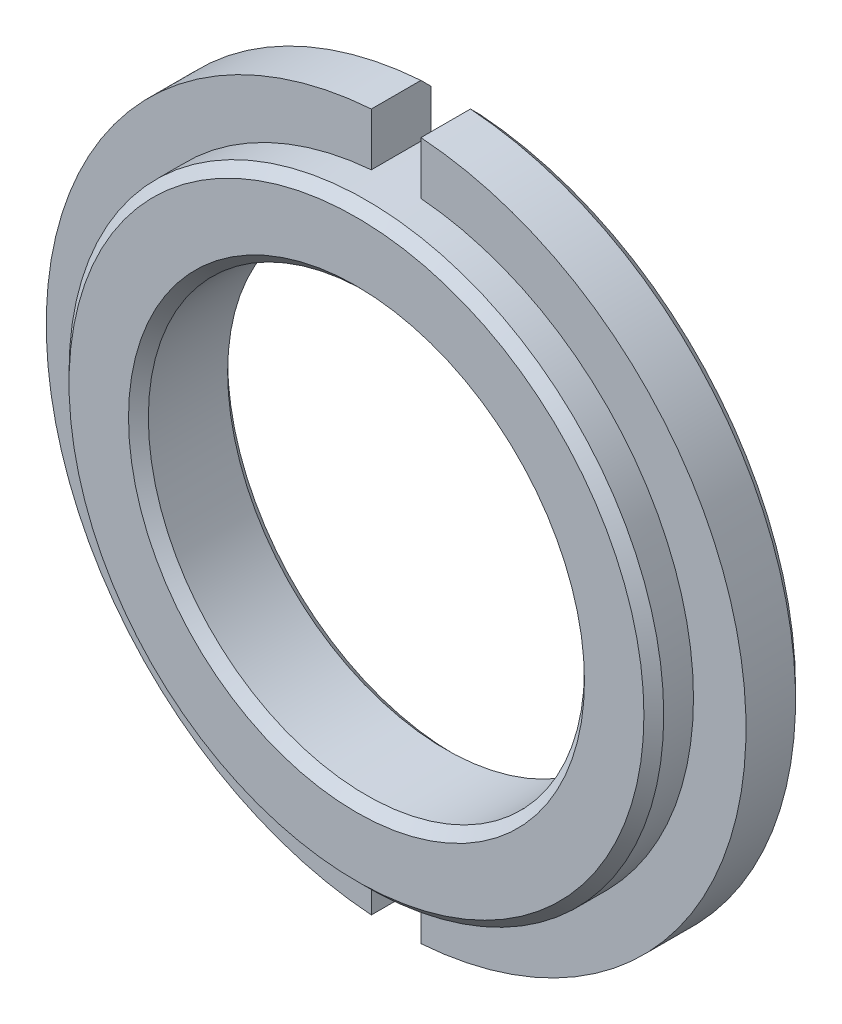
from build123d import *

# Parameters (mm, degrees)
SKETCH1_R           = 17.65
SKETCH1_R_2         = 11
BOSS_EXTRUDE1_DEPTH = 5
CUT_EXTRUDE1_START  = -2
SKETCH2_R           = 17.65
SKETCH2_R_2         = 15
CUT_EXTRUDE1_DEPTH  = 2
CUT_EXTRUDE3_REACH  = 27.141
CHAMFER1_SIZE       = 0.5


with BuildPart() as part:
    # Sketch1 → Boss-Extrude1 (new body)
    with BuildSketch(Plane.XY):
        Circle(SKETCH1_R)
        Circle(SKETCH1_R_2, mode=Mode.SUBTRACT)
    extrude(amount=BOSS_EXTRUDE1_DEPTH)

    # Sketch2 → Cut-Extrude1 (cut)
    with BuildSketch(Plane.XY.offset(5).offset(CUT_EXTRUDE1_START)):
        Circle(SKETCH2_R)
        Circle(SKETCH2_R_2, mode=Mode.SUBTRACT)
    extrude(amount=CUT_EXTRUDE1_DEPTH, mode=Mode.SUBTRACT)

    # Sketch3 → Cut-Extrude3 (cut, up to next)
    with BuildSketch(Plane.XY.offset(3), mode=Mode.PRIVATE) as cut_extrude3_sk1:
        with BuildLine():
            Line((1.25, 17.605680901), (1.25, 14.947825929))
            ThreePointArc((1.25, 14.947825929), (0, 15), (-1.25, 14.947825929))
            Line((-1.25, 14.947825929), (-1.25, 17.605680901))
            ThreePointArc((-1.25, 17.605680901), (0, 17.65), (1.25, 17.605680901))
        make_face()
    cut_extrude3_tool1 = extrude(cut_extrude3_sk1.sketch, amount=-CUT_EXTRUDE3_REACH, mode=Mode.PRIVATE) & part.part
    # Sketch3 → Cut-Extrude3 (cut, up to next)
    with BuildSketch(Plane.XY.offset(3), mode=Mode.PRIVATE) as cut_extrude3_sk2:
        with BuildLine():
            Line((1.25, -14.947825929), (1.25, -17.605680901))
            ThreePointArc((1.25, -17.605680901), (0, -17.65), (-1.25, -17.605680901))
            Line((-1.25, -17.605680901), (-1.25, -14.947825929))
            ThreePointArc((-1.25, -14.947825929), (0, -15), (1.25, -14.947825929))
        make_face()
    cut_extrude3_tool2 = extrude(cut_extrude3_sk2.sketch, amount=-CUT_EXTRUDE3_REACH, mode=Mode.PRIVATE) & part.part
    add(cut_extrude3_tool1.solids().sort_by_distance((0, 16.308915, 3))[0], mode=Mode.SUBTRACT)
    add(cut_extrude3_tool2.solids().sort_by_distance((0, -16.308915, 3))[0], mode=Mode.SUBTRACT)

    # Chamfer1
    chamfer1_edges = [part.edges().sort_by_distance(p)[0] for p in [
        (-11, 0, 5),
        (-15, 0, 5),
        (17.65, 0, 0),
        (-17.65, 0, 0),
        (-11, 0, 0),
    ]]
    chamfer(chamfer1_edges, length=CHAMFER1_SIZE)


solid = part.part
